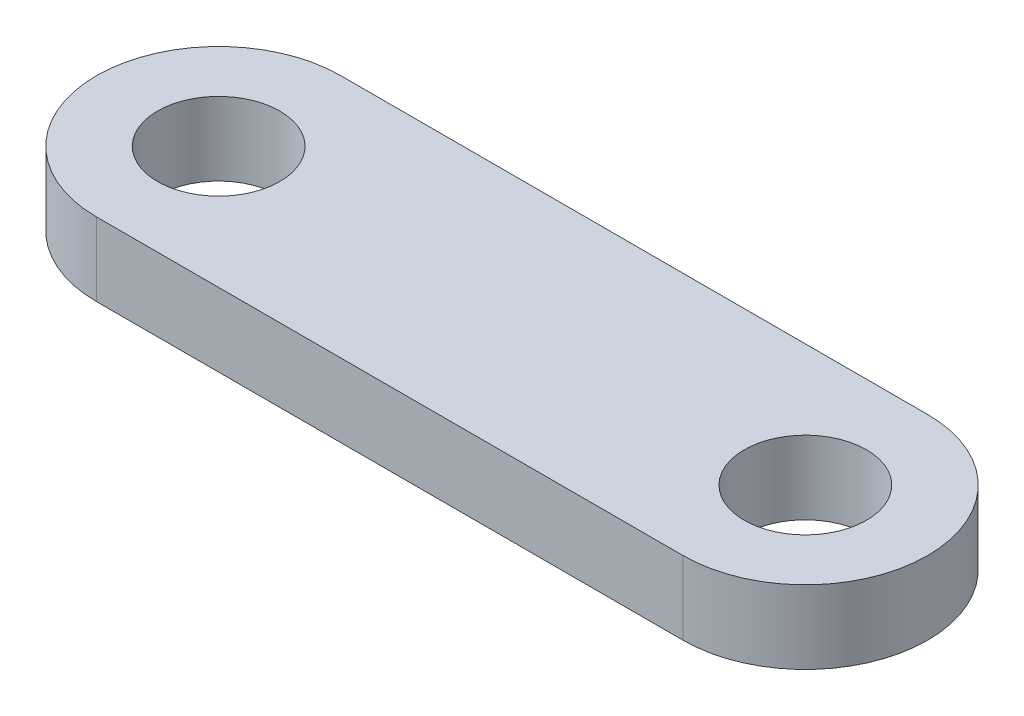
from build123d import *

# Parameters (mm, degrees)
SKETCH1_R           = 3.175
BOSS_EXTRUDE1_DEPTH = 3.81


with BuildPart() as part:
    # Sketch1 → Boss-Extrude1 (new body)
    with BuildSketch(Plane(origin=(0, 0, 0), x_dir=(1, 0, 0), z_dir=(0, 1, 0))):
        with BuildLine():
            Line((-15.24, 6.35), (15.24, 6.35))
            ThreePointArc((15.24, 6.35), (21.59, 0), (15.24, -6.35))
            Line((15.24, -6.35), (-15.24, -6.35))
            ThreePointArc((-15.24, -6.35), (-21.59, 0), (-15.24, 6.35))
        make_face()
        with Locations((-15.24, 0)):
            Circle(SKETCH1_R, mode=Mode.SUBTRACT)
        with Locations((15.24, 0)):
            Circle(SKETCH1_R, mode=Mode.SUBTRACT)
    extrude(amount=BOSS_EXTRUDE1_DEPTH)


solid = part.part
